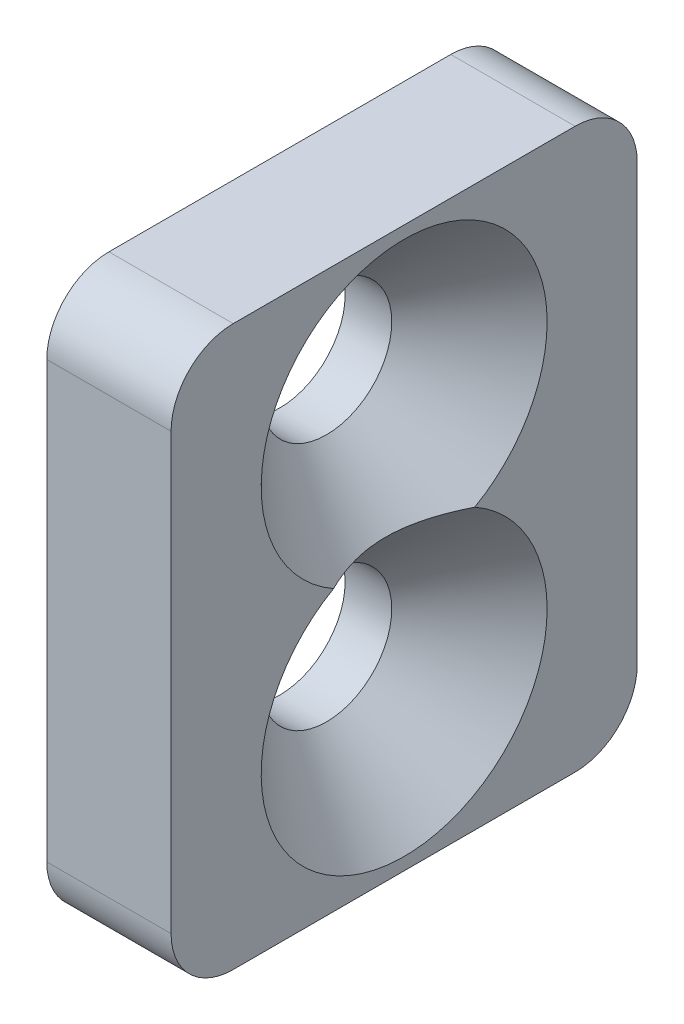
from build123d import *

# Parameters (mm, degrees)
SKETCH4_W           = 15
SKETCH4_H           = 18
SKETCH4_R           = 2.1
BOSS_EXTRUDE1_DEPTH = 4
FILLET1_R           = 2
CHAMFER1_SIZE       = 2.5


with BuildPart() as part:
    # Sketch4 → Boss-Extrude1 (new body)
    with BuildSketch(Plane(origin=(0, 0, 0), x_dir=(0, 0, -1), z_dir=(1, 0, 0))):
        Rectangle(SKETCH4_W, SKETCH4_H)
        with Locations((0, 4)):
            Circle(SKETCH4_R, mode=Mode.SUBTRACT)
        with Locations((0, -4)):
            Circle(SKETCH4_R, mode=Mode.SUBTRACT)
    extrude(amount=BOSS_EXTRUDE1_DEPTH)

    # Fillet1
    fillet1_edges = [part.edges().sort_by_distance(p)[0] for p in [
        (2, -9, -7.5),
        (2, -9, 7.5),
        (2, 9, 7.5),
        (2, 9, -7.5),
    ]]
    fillet(fillet1_edges, radius=FILLET1_R)

    # Chamfer1
    # the kernel refuses this chamfer: 2.5 mm, written as the material it takes off along each edge
    with BuildSketch(Plane(origin=(4, 4, 0), x_dir=(0, 0, -1), z_dir=(0, -1, 0))) as chamfer1_piece_1:
        Polygon((2.1 + CHAMFER1_SIZE, 0), (2.1, -CHAMFER1_SIZE), (2.1, 0), align=None)
    revolve(axis=Axis((4, 4, 0), (1, 0, 0)), mode=Mode.SUBTRACT)
    with BuildSketch(Plane(origin=(4, -4, 0), x_dir=(0, 0, -1), z_dir=(0, -1, 0))) as chamfer1_piece_2:
        Polygon((2.1 + CHAMFER1_SIZE, 0), (2.1, -CHAMFER1_SIZE), (2.1, 0), align=None)
    revolve(axis=Axis((4, -4, 0), (1, 0, 0)), mode=Mode.SUBTRACT)


solid = part.part
